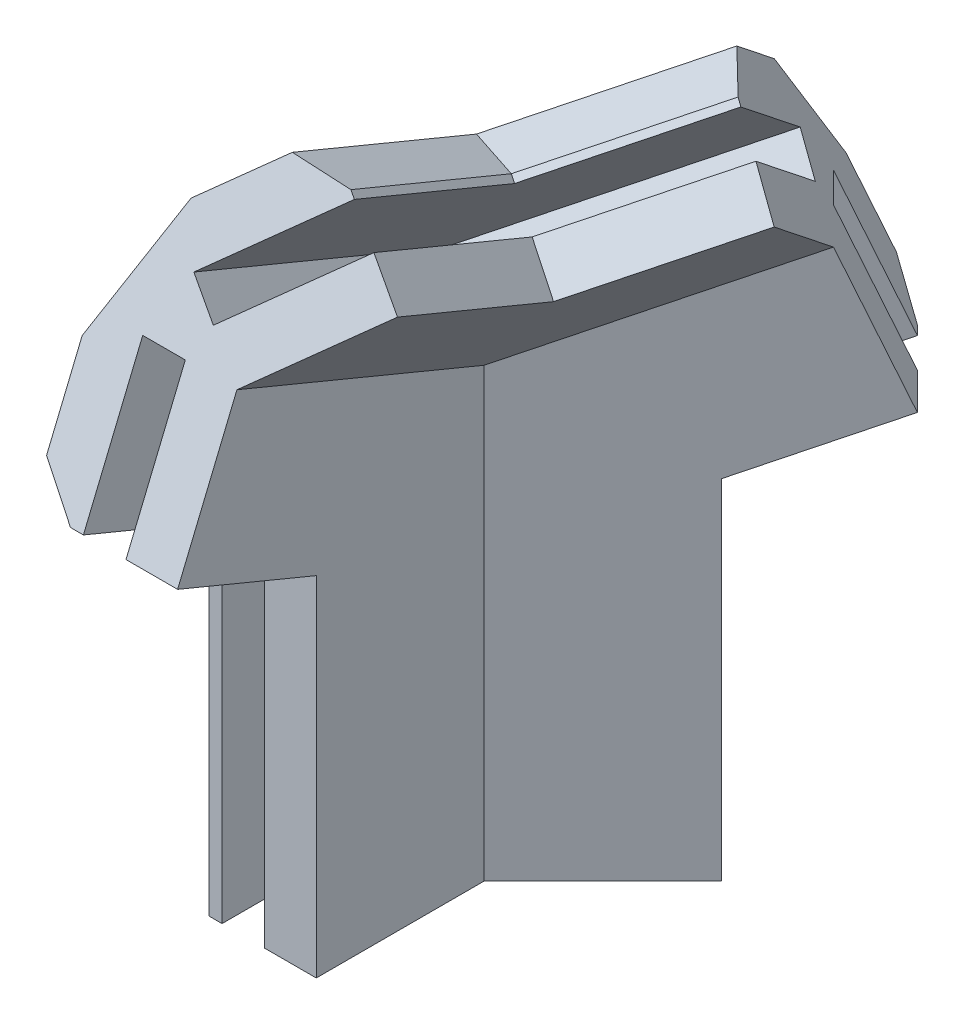
from build123d import *
from OCP.BRepFilletAPI import BRepFilletAPI_MakeChamfer

# Parameters (mm, degrees)
BOSS_EXTRUDE1_DEPTH = 80
CUT_EXTRUDE2_DEPTH  = 82.280481137
SKETCH6_W           = 4
SKETCH6_H           = 13
BOSS_EXTRUDE6_DEPTH = 70
BOSS_EXTRUDE7_REACH = 148.366
BOSS_EXTRUDE8_REACH = 152.403
CUT_EXTRUDE3_DEPTH  = 146.557626962
CUT_EXTRUDE4_DEPTH  = 142.8119282
CHAMFER3_START      = -30
CHAMFER3_OUTLINE_W  = 24
CHAMFER3_OUTLINE_H  = 27
CHAMFER3_DEPTH      = 4.140431355
CHAMFER4_START      = -11
CHAMFER4_OUTLINE_W  = 75
CHAMFER4_OUTLINE_H  = 14
CHAMFER4_DEPTH      = 2.728063486
CHAMFER5_START      = -38
CHAMFER5_OUTLINE_W  = 21
CHAMFER5_OUTLINE_H  = 26
CHAMFER5_DEPTH      = 3.409757195
CHAMFER7_SIZE       = 3
CHAMFER7_SIZE2      = 3.268453219
CHAMFER8_START      = -40
CHAMFER8_DEPTH      = 3.210737533
SKETCH20_W          = 40
SKETCH20_H          = 40
CUT_EXTRUDE5_DEPTH  = 103.734976835


with BuildPart() as part:
    # Sketch1 → Boss-Extrude1 (new body)
    with BuildSketch(Plane(origin=(0, 0, 0), x_dir=(1, 0, 0), z_dir=(0, 1, 0))):
        Polygon((3.622068507, 4.197822071), (3.622068507, -8.802177929), (-0.377931493, -8.802177929), (-0.377931493, 4.197822071), (-3.677931493, 4.197822071), (-3.677931493, -8.802177929), (-7.677931493, -8.802177929), (-7.677931493, 8.878435326), align=None)
    extrude(amount=BOSS_EXTRUDE1_DEPTH)

    # Sketch2 → Cut-Extrude2 (cut, through all)
    with BuildSketch(Plane.ZY.offset(7.677931493)):
        Polygon((8.802177929, 80), (-8.878435326, 80), (-8.878435326, 72.676450199), align=None)
    extrude(amount=-CUT_EXTRUDE2_DEPTH, mode=Mode.SUBTRACT)

    # Sketch6 → Boss-Extrude6 (add, along a direction that is not the sketch's normal)
    with BuildSketch(Plane.XY.offset(8.802177929)):
        with Locations((-5.677931493, 73.5)):
            Rectangle(SKETCH6_W, SKETCH6_H)
        with Locations((1.622068507, 73.5)):
            Rectangle(SKETCH6_W, SKETCH6_H)
    extrude(amount=BOSS_EXTRUDE6_DEPTH, dir=(0, 0.3826834323650841, 0.9238795325112892))

    # Boss-Extrude7: up to this plane
    boss_extrude7_end = Plane(origin=(3.622068507, 80, -4.197822071), z_dir=(-0.3826834323650841, 0, 0.9238795325112892))
    # Sketch7 → Boss-Extrude7 (add, up to the surface)
    with BuildSketch(Plane.XY.offset(73.473745205), mode=Mode.PRIVATE) as boss_extrude7_sk1:
        Polygon((-7.677931493, 106.787840266), (3.622068507, 106.787840266), (-7.677931493, 111.46845352), align=None)
    boss_extrude7_tool1 = split(extrude(boss_extrude7_sk1.sketch, amount=BOSS_EXTRUDE7_REACH, dir=(0, -0.382683432365, -0.923879532511), mode=Mode.PRIVATE), bisect_by=boss_extrude7_end, keep=Keep.BOTH, mode=Mode.PRIVATE)
    add(boss_extrude7_tool1.solids().sort_by_distance((-3.911265, 108.348045, 73.473745))[0])

    # Boss-Extrude8: up to this plane
    boss_extrude8_end = Plane(origin=(3.622068507, 80, -4.197822071), z_dir=(-0.3826834323650841, 0, 0.9238795325112892))
    # Sketch16 → Boss-Extrude8 (add, up to the surface)
    with BuildSketch(Plane.XY.offset(73.473745205), mode=Mode.PRIVATE) as boss_extrude8_sk1:
        Polygon((3.622068507, 106.787840266), (12.814456663, 115.980228421), (9.986029538, 118.808655546), (0.793641383, 109.61626739), (-1.539810995, 111.949719768), (7.65257716, 121.142107924), (4.824150035, 123.970535048), (-7.677931493, 111.46845352), align=None)
    boss_extrude8_tool1 = split(extrude(boss_extrude8_sk1.sketch, amount=BOSS_EXTRUDE8_REACH, dir=(0, -0.382683432365, -0.923879532511), mode=Mode.PRIVATE), bisect_by=boss_extrude8_end, keep=Keep.BOTH, mode=Mode.PRIVATE)
    add(boss_extrude8_tool1.solids().sort_by_distance((8.029162, 111.573135, 73.473745))[0])

    # Sketch17 → Cut-Extrude3 (cut, through all)
    with BuildSketch(Plane.ZY.offset(7.677931493)):
        Polygon((73.473745205, 93.787840266), (58.313175353, 130.388693616), (73.473745205, 136.668407262), align=None)
    extrude(amount=-CUT_EXTRUDE3_DEPTH, mode=Mode.SUBTRACT)

    # Sketch19 → Cut-Extrude4 (cut, through all)
    with BuildSketch(Plane.ZY.offset(7.677931493)):
        Polygon((73.473745205, 93.787840266), (19.545714219, 71.450118439), (5.092625448, 106.342961367), (59.020656435, 128.680683193), align=None)
    extrude(amount=-CUT_EXTRUDE4_DEPTH, mode=Mode.SUBTRACT)

    # Mirror9: part across plane


with BuildPart() as part_1:
    add(part.part)
    add(part.part.mirror(Plane(origin=(2.014593878, 0, -4.863659863), x_dir=(0.9238795325112891, 0, 0.3826834323650842), z_dir=(0.3826834323650841, 0, -0.9238795325112892))))

    # Chamfer3: read off the stored shape, not the designer's step
    # Chamfer3 outline → Chamfer3 (cut)
    with BuildSketch(Plane(origin=(0, 0, 0), x_dir=(0.4459030144065531, 0.4972805165228299, -0.7442328866893325), z_dir=(0.8950812821990801, -0.24773044161799307, 0.3707548065131521)).offset(CHAMFER3_START)):
        with Locations((45, 59.5)):
            Rectangle(CHAMFER3_OUTLINE_W, CHAMFER3_OUTLINE_H)
    extrude(amount=CHAMFER3_DEPTH, mode=Mode.SUBTRACT)

    # Chamfer4: read off the stored shape, not the designer's step
    # Chamfer4 outline → Chamfer4 (cut)
    with BuildSketch(Plane(origin=(0, 0, 0), x_dir=(0, 1, 0), z_dir=(0.9238795325112892, 0, 0.3826834323650841)).offset(CHAMFER4_START)):
        with Locations((36.5, -5)):
            Rectangle(CHAMFER4_OUTLINE_W, CHAMFER4_OUTLINE_H)
    extrude(amount=CHAMFER4_DEPTH, mode=Mode.SUBTRACT)

    # Chamfer5: read off the stored shape, not the designer's step
    # Chamfer5 outline → Chamfer5 (cut)
    with BuildSketch(Plane(origin=(0, 0, 0), x_dir=(0.3652745046018862, 0.9288881868246626, 0.061165943673236425), z_dir=(0.9161327263409628, -0.37036027915745895, 0.15340825059130198)).offset(CHAMFER5_START)):
        with Locations((74.5, 5)):
            Rectangle(CHAMFER5_OUTLINE_W, CHAMFER5_OUTLINE_H)
    extrude(amount=CHAMFER5_DEPTH, mode=Mode.SUBTRACT)

    # Chamfer7: one chamfer whose edges measure the first distance from different faces: ONE call of the kernel's chamfer builder (chamfer() names one face for all edges)
    chamfer7_edges_1 = [part_1.edges().sort_by_distance(p)[0] for p in [
        (-7.677931493, 69.225059219, 14.173946074),
        (8.622563718, 69.225059219, -25.178930536),
        (4.824150035, 33.5, -21.380516854),
        (-7.677931493, 33.5, 8.802177929),
    ]]
    chamfer7_edges_2 = [part_1.edges().sort_by_distance(p)[0] for p in [
        (9.269880183, 94.608411482, -8.145633747),
        (4.824150035, 94.608411482, 2.587308271),
    ]]
    chamfer7_side_2 = [part_1.faces().sort_by_distance(p)[0] for p in [
        (3.501171082, 89.374799079, -6.853796043),
    ]]
    chamfer7 = BRepFilletAPI_MakeChamfer(part_1.part.solid().wrapped)
    for e in chamfer7_edges_1:
        chamfer7.Add(CHAMFER7_SIZE, e.wrapped)
    for e in chamfer7_edges_2:
        chamfer7.Add(CHAMFER7_SIZE, CHAMFER7_SIZE2, e.wrapped, chamfer7_side_2[0].wrapped)  # the first distance lies on this face
    add(Compound.cast(chamfer7.Shape()), mode=Mode.REPLACE)

    # Chamfer8: read off the stored shape, not the designer's step
    # Chamfer8 outline → Chamfer8 (cut)
    with BuildSketch(Plane(origin=(0, 0, 0), x_dir=(0.6542484614665716, 0.42811862617005, -0.6234367590982206), z_dir=(0.7562796775456972, -0.37036027915745917, 0.5393276489795283)).offset(CHAMFER8_START)):
        Polygon((57.189510074, 50), (58.060381385, 66), (36, 66), (36, 50), align=None)
    extrude(amount=CHAMFER8_DEPTH, mode=Mode.SUBTRACT)

    # Sketch20 → Cut-Extrude5 (cut, through all)
    with BuildSketch(Plane(origin=(-7.642272839, 0, -3.165533057), x_dir=(-0.3826834323650836, 0, 0.9238795325112894), z_dir=(-0.9238795325112893, 0, -0.38268343236508356))):
        with Locations((-6.292508137, 20)):
            Rectangle(SKETCH20_W, SKETCH20_H)
    extrude(amount=-CUT_EXTRUDE5_DEPTH, mode=Mode.SUBTRACT)


solid = part_1.part
